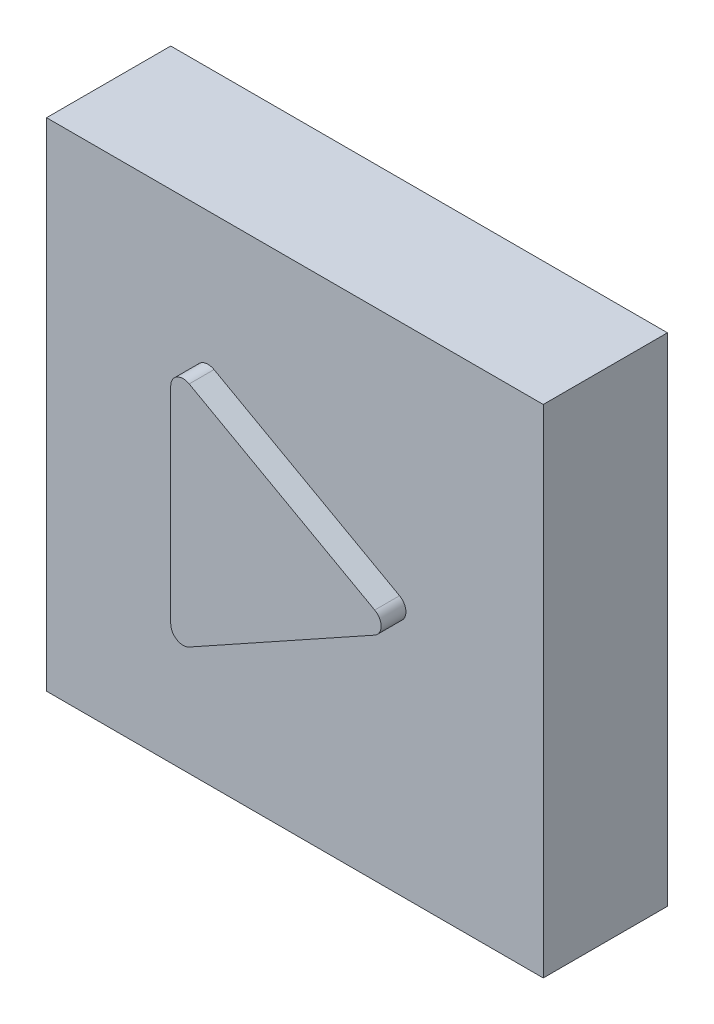
from build123d import *

# Parameters (mm, degrees)
SKETCH1_W           = 20
SKETCH1_H           = 20
BOSS_EXTRUDE1_DEPTH = 5
SKETCH6_R           = 0.75
CUT_EXTRUDE1_DEPTH  = 5
BOSS_EXTRUDE2_DEPTH = 1


with BuildPart() as part:
    # Sketch1 → Boss-Extrude1 (new body)
    with BuildSketch(Plane.XY):
        Rectangle(SKETCH1_W, SKETCH1_H)
    extrude(amount=BOSS_EXTRUDE1_DEPTH)

    # Sketch6 → Cut-Extrude1 (cut)
    with BuildSketch(Plane.XY.offset(5)):
        Circle(SKETCH6_R)
    extrude(amount=-CUT_EXTRUDE1_DEPTH, mode=Mode.SUBTRACT)

    # Sketch2 → Boss-Extrude2 (add)
    with BuildSketch(Plane.XY.offset(5)):
        with BuildLine():
            Line((-4, 4.15024277), (-4, -4.15024277))
            ThreePointArc((-4, -4.15024277), (-3.753563865, -4.581178225), (-3.257178534, -4.587321408))
            Line((-3.257178534, -4.587321408), (4.213258451, -0.437078638))
            ThreePointArc((4.213258451, -0.437078638), (4.470436986, 0), (4.213258451, 0.437078638))
            Line((4.213258451, 0.437078638), (-3.257178534, 4.587321408))
            ThreePointArc((-3.257178534, 4.587321408), (-3.753563865, 4.581178225), (-4, 4.15024277))
        make_face()
    extrude(amount=BOSS_EXTRUDE2_DEPTH)


solid = part.part
